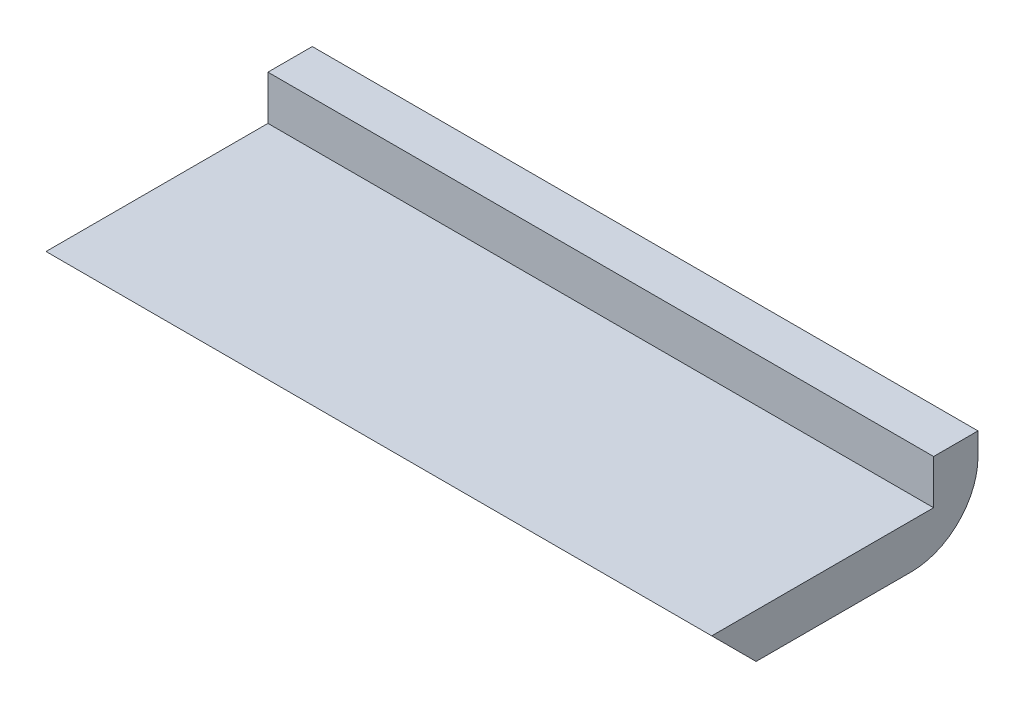
from build123d import *

# Parameters (mm, degrees)
CROQUIS1_W                   = 30
CROQUIS1_H                   = 10
SALIENTE_EXTRUIR1_DEPTH      = 2
SALIENTE_EXTRUIR2_DEPTH      = 2
SALIENTE_EXTRUIR2_DEPTH_BACK = 2
CROQUIS2_W                   = 30
CROQUIS2_H                   = 2
CHAFL_N1_SIZE                = 2
REDONDEO1_R                  = 3
CORTAR_EXTRUIR1_DEPTH        = 1.3


with BuildPart() as part:
    # Croquis1 → Saliente-Extruir1 (new body)
    with BuildSketch(Plane(origin=(0, 0, 0), x_dir=(1, 0, 0), z_dir=(0, 1, 0))):
        Rectangle(CROQUIS1_W, CROQUIS1_H)
    extrude(amount=SALIENTE_EXTRUIR1_DEPTH)

    # Croquis2 → Saliente-Extruir2 (add, two sides: drawn at the far end of the back side and taken through both)
    with BuildSketch(Plane(origin=(0, 2, 0), x_dir=(1, 0, 0), z_dir=(0, 1, 0)).offset(-SALIENTE_EXTRUIR2_DEPTH_BACK)):
        with Locations((0, 6)):
            Rectangle(CROQUIS2_W, CROQUIS2_H)
    extrude(amount=SALIENTE_EXTRUIR2_DEPTH + SALIENTE_EXTRUIR2_DEPTH_BACK)

    # Chaflán1
    chafl_n1_edges = [part.edges().sort_by_distance(p)[0] for p in [
        (0, 0, 5),
    ]]
    chamfer(chafl_n1_edges, length=CHAFL_N1_SIZE - 0.0001)  # a hair under: the kernel refuses the full size

    # Redondeo1
    redondeo1_edges = [part.edges().sort_by_distance(p)[0] for p in [
        (0, 0, -7),
    ]]
    fillet(redondeo1_edges, radius=REDONDEO1_R)

    # Croquis3 → Cortar-Extruir1 (cut)
    with BuildSketch(Plane.XZ):
        Polygon((-9.961494987, -0.07018817), (-8.709002423, 1.683238665), (-7.549155707, 1.683238665), (-7.549155707, -3.398633507), (-8.83001578, -3.398633507), (-8.83001578, -0.22414092), (-9.330931139, -0.930250522), align=None)
        Polygon((-11.80023979, 1.683238665), (-13, 1.683238665), (-13, -3.398633507), (-11.724069575, -3.398633507), (-11.724069575, -0.22414092), (-10.233410768, -2.257336324), (-9.583176724, -1.340741346), align=None)
        with BuildLine():
            Line((-6.600409237, 1.683238665), (-6.600409237, -1.725226293))
            ThreePointArc((-6.600409237, -1.725226293), (-4.45912989, -3.411949657), (-2.317850543, -1.725226293))
            Line((-2.317850543, -1.725226293), (-2.317850543, 1.683238665))
            Line((-2.317850543, 1.683238665), (-3.56164133, 1.683238665))
            Line((-3.56164133, 1.683238665), (-3.56164133, -1.725226293))
            ThreePointArc((-3.56164133, -1.725226293), (-4.455396596, -2.280675862), (-5.349151863, -1.725226293))
            Line((-5.349151863, -1.725226293), (-5.349151863, 1.683238665))
            Line((-5.349151863, 1.683238665), (-6.600409237, 1.683238665))
        make_face()
        Polygon((-0.147635828, -1.165769584), (-1.416632441, 0.454814455), (-1.416632441, -3.411949657), (-0.147635828, -3.411949657), align=None)
        Polygon((-1.416632441, 1.126001398), (-1.416632441, 1.683238665), (-0.354158469, 1.683238665), (3.073485226, -2.863879645), (3.073485226, -3.411949657), (2.004100926, -3.411949657), align=None)
        Polygon((1.874218963, -0.552422461), (1.874218963, 1.683238665), (3.073485226, 1.683238665), (3.073485226, -2.083956703), align=None)
        Polygon((6.967028865, 1.683238665), (5.642411569, 1.683238665), (3.668591411, -3.411949657), (4.971319865, -3.411949657), (6.315646772, 0.454814455), (7.616337035, -3.411949657), (8.919127609, -3.411949657), align=None)
        Polygon((9.744634122, -1.460252001), (7.972604821, 1.683238665), (9.46859716, 1.683238665), (10.442731706, -0.22414092), (11.480463321, 1.683238665), (12.951143356, 1.683238665), (11.048523586, -1.460252001), (11.048523586, -3.411949657), (9.744634122, -3.411949657), align=None)
    extrude(amount=-CORTAR_EXTRUIR1_DEPTH, mode=Mode.SUBTRACT)


solid = part.part
